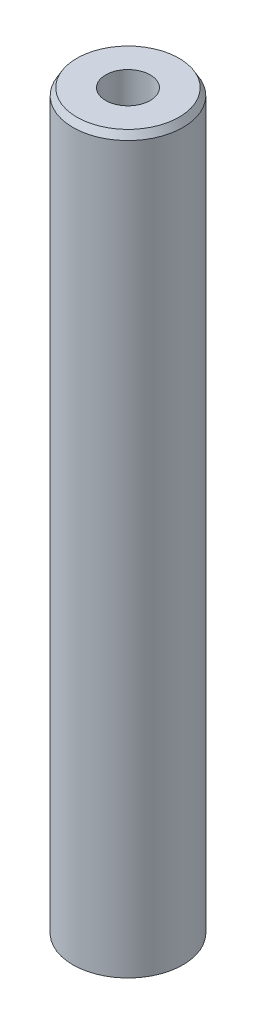
from build123d import *
from OCP.BRepFilletAPI import BRepFilletAPI_MakeChamfer

# Parameters (mm, degrees)
SKETCH1_R           = 10
BOSS_EXTRUDE1_DEPTH = 133.703424018
SKETCH2_R           = 4.042329205
CUT_EXTRUDE1_DEPTH  = 135.449267734
CHAMFER1_SIZE       = 1.251373661
CHAMFER1_SIZE2      = 0.72248092


with BuildPart() as part:
    # Sketch1 → Boss-Extrude1 (new body)
    with BuildSketch(Plane(origin=(0, 0, 0), x_dir=(1, 0, 0), z_dir=(0, 1, 0))):
        Circle(SKETCH1_R)
    extrude(amount=BOSS_EXTRUDE1_DEPTH)

    # Sketch2 → Cut-Extrude1 (cut, through all)
    with BuildSketch(Plane(origin=(0, 0, 0), x_dir=(1, 0, 0), z_dir=(0, 1, 0))):
        Circle(SKETCH2_R)
    extrude(amount=CUT_EXTRUDE1_DEPTH, mode=Mode.SUBTRACT)

    # Chamfer1: one chamfer whose edges measure the first distance from different faces: ONE call of the kernel's chamfer builder (chamfer() names one face for all edges)
    chamfer1_edges_1 = [part.edges().sort_by_distance(p)[0] for p in [
        (-10, 133.703424018, 0),
    ]]
    chamfer1_side_1 = [part.faces().sort_by_distance(p)[0] for p in [
        (-10, 66.851712009, 0),
    ]]
    chamfer1_edges_2 = [part.edges().sort_by_distance(p)[0] for p in [
        (-10, 0, 0),
    ]]
    chamfer1_side_2 = [part.faces().sort_by_distance(p)[0] for p in [
        (-9.717157288, 0, 0),
    ]]
    chamfer1 = BRepFilletAPI_MakeChamfer(part.part.solid().wrapped)
    for e in chamfer1_edges_1:
        chamfer1.Add(CHAMFER1_SIZE, CHAMFER1_SIZE2, e.wrapped, chamfer1_side_1[0].wrapped)  # the first distance lies on this face
    for e in chamfer1_edges_2:
        chamfer1.Add(CHAMFER1_SIZE, CHAMFER1_SIZE2, e.wrapped, chamfer1_side_2[0].wrapped)  # the first distance lies on this face
    add(Compound.cast(chamfer1.Shape()), mode=Mode.REPLACE)


solid = part.part
